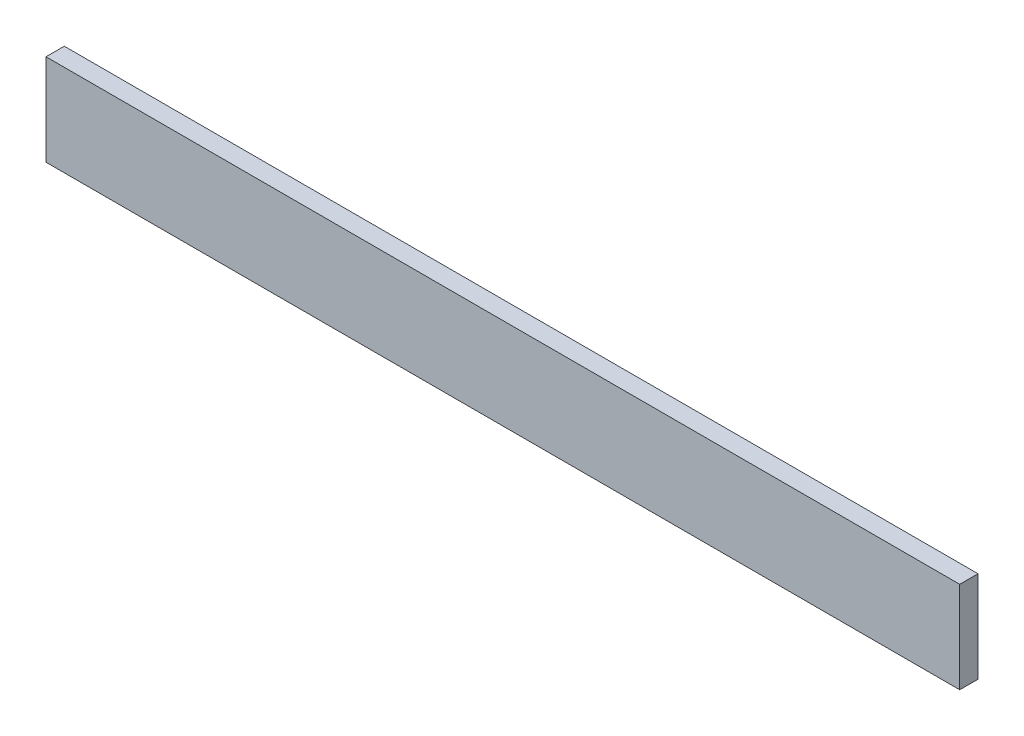
from build123d import *

# Parameters (mm, degrees)
SKETCH1_W           = 300
SKETCH1_H           = 30
BOSS_EXTRUDE1_DEPTH = 6


with BuildPart() as part:
    # Sketch1 → Boss-Extrude1 (new body)
    with BuildSketch(Plane.XY):
        with Locations((150, 15)):
            Rectangle(SKETCH1_W, SKETCH1_H)
    extrude(amount=BOSS_EXTRUDE1_DEPTH)


solid = part.part
